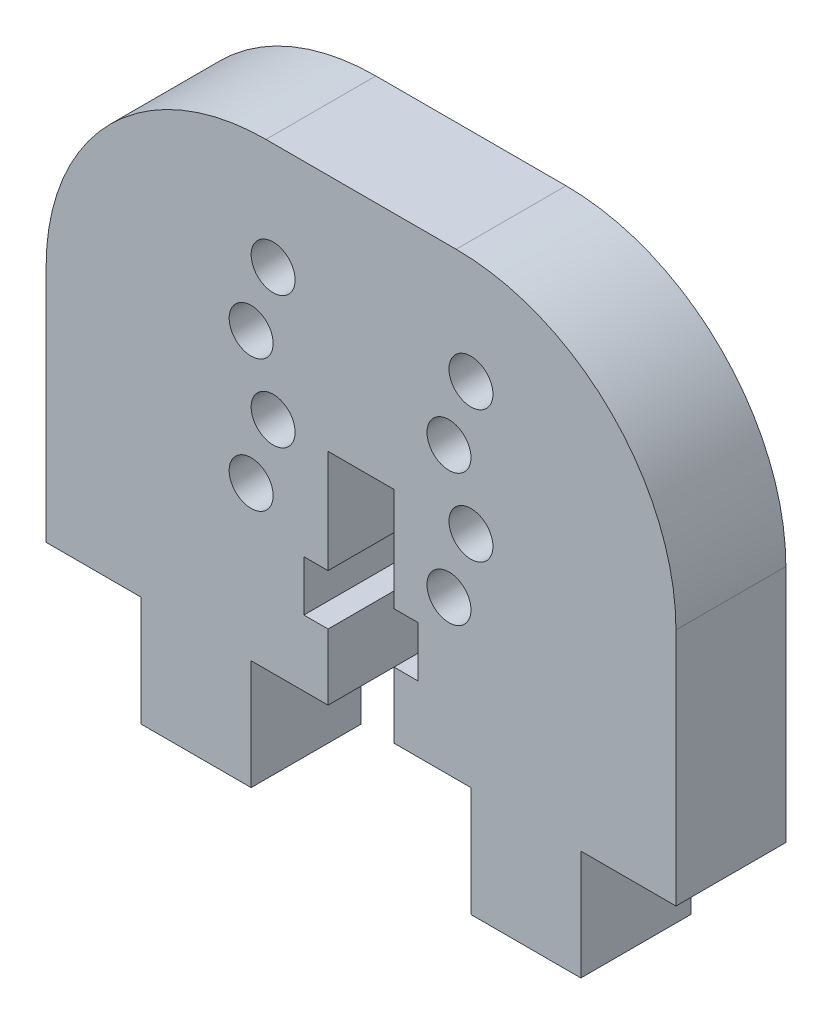
from build123d import *

# Parameters (mm, degrees)
SKETCH1_R           = 1
BOSS_EXTRUDE1_DEPTH = 5
FILLET1_R           = 10


with BuildPart() as part:
    # Sketch1 → Boss-Extrude1 (new body)
    with BuildSketch(Plane.XY):
        Polygon((-14.326662673, 10.43799709), (-14.326662673, -10.43799709), (-10, -10.43799709), (-10, -15.43799709), (-5, -15.43799709), (-5, -10.43799709), (-1.5, -10.43799709), (-1.5, -7.43799709), (-2.6, -7.43799709), (-2.6, -5.13799709), (-1.5, -5.13799709), (-1.5, -0.43799709), (1.5, -0.43799709), (1.5, -5.13799709), (2.6, -5.13799709), (2.6, -7.43799709), (1.5, -7.43799709), (1.5, -10.43799709), (5, -10.43799709), (5, -15.43799709), (10, -15.43799709), (10, -10.43799709), (14.326662673, -10.43799709), (14.326662673, 10.43799709), align=None)
        with Locations((-5, -3.43799709)):
            Circle(SKETCH1_R, mode=Mode.SUBTRACT)
        with Locations((4, -3.43799709)):
            Circle(SKETCH1_R, mode=Mode.SUBTRACT)
        with Locations((-4, -0.43799709)):
            Circle(SKETCH1_R, mode=Mode.SUBTRACT)
        with Locations((-5, 2.56200291)):
            Circle(SKETCH1_R, mode=Mode.SUBTRACT)
        with Locations((-4, 5.56200291)):
            Circle(SKETCH1_R, mode=Mode.SUBTRACT)
        with Locations((5, -0.43799709)):
            Circle(SKETCH1_R, mode=Mode.SUBTRACT)
        with Locations((4, 2.56200291)):
            Circle(SKETCH1_R, mode=Mode.SUBTRACT)
        with Locations((5, 5.56200291)):
            Circle(SKETCH1_R, mode=Mode.SUBTRACT)
    extrude(amount=BOSS_EXTRUDE1_DEPTH)

    # Fillet1
    fillet1_edges = [part.edges().sort_by_distance(p)[0] for p in [
        (14.326662673, 10.43799709, 2.5),
        (-14.326662673, 10.43799709, 2.5),
    ]]
    fillet(fillet1_edges, radius=FILLET1_R)


solid = part.part
